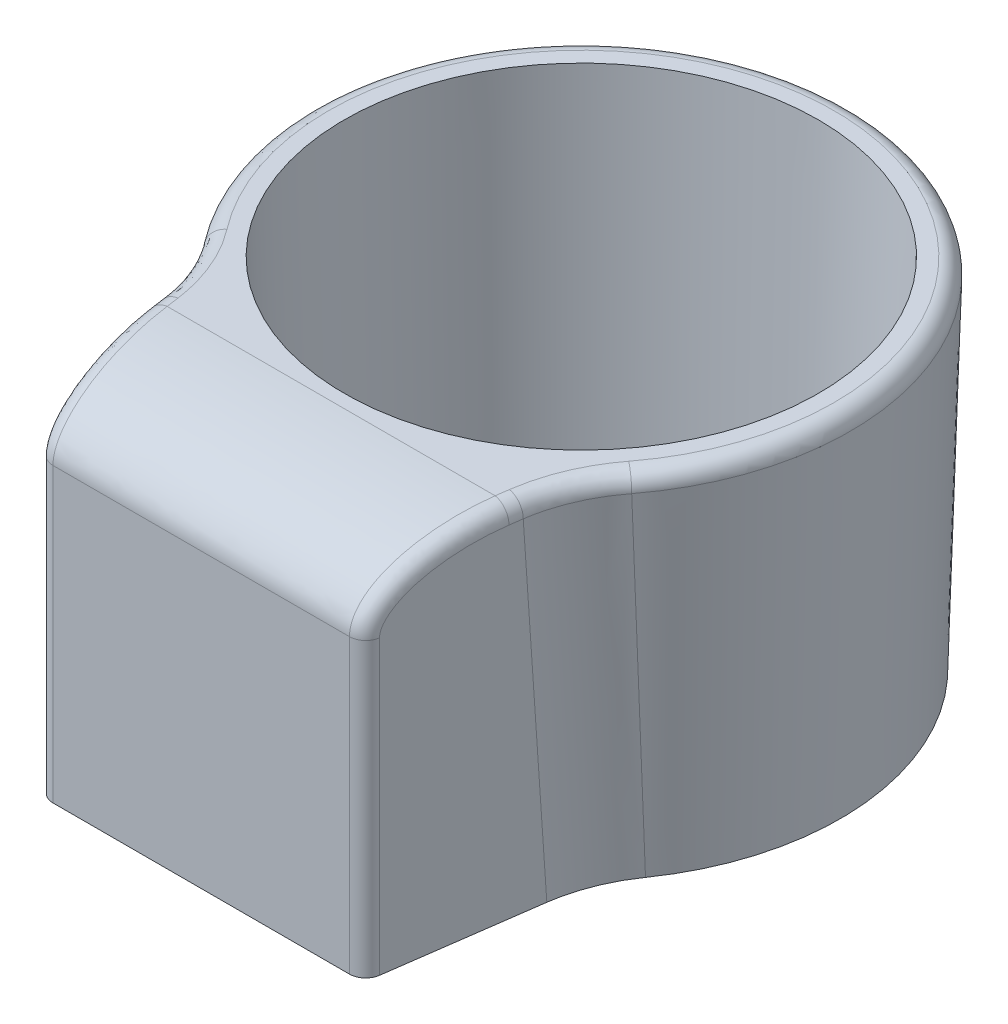
from build123d import *

# Parameters (mm, degrees)
BOSS_EXTRUDE1_DEPTH = 22
CUT_EXTRUDE1_DEPTH  = 20
BOSS_EXTRUDE2_DEPTH = 6.5
BOSS_EXTRUDE3_DEPTH = 10
FILLET1_R           = 10
FILLET3_SIZE        = 8
FILLET3_SIZE_2      = 4
FILLET5_R           = 1.5
FILLET6_R           = 1


with BuildPart() as part:
    # Sketch2 → Revolve1 (revolve)
    with BuildSketch(Plane.XY, mode=Mode.PRIVATE) as revolve1_sk:
        Polygon((-15.96, 0), (-16.6, 22), (-14.599153898, 22), (-13.959153898, 0), align=None)
    revolve(revolve1_sk.sketch.rotate(Axis((0, 0, 0), (0, 1, 0)), 270), axis=Axis((0, 0, 0), (0, 1, 0)))

    # Sketch4 → Boss-Extrude1 (add)
    with BuildSketch(Plane(origin=(0, 0, 0), x_dir=(1, 0, 0), z_dir=(0, 1, 0))):
        with BuildLine():
            Line((-11.75, -10.800884223), (-10, -23.41))
            Line((-10, -23.41), (10, -23.41))
            Line((10, -23.41), (11.75, -10.800884223))
            ThreePointArc((11.75, -10.800884223), (0, -15.96), (-11.75, -10.800884223))
        make_face()
    extrude(amount=BOSS_EXTRUDE1_DEPTH)

    # Sketch4<3> → Cut-Extrude1 (cut)
    with BuildSketch(Plane(origin=(0, 0, 0), x_dir=(1, 0, 0), z_dir=(0, 1, 0))):
        with BuildLine():
            Line((-10.009354966, -12.431187118), (-8.693804944, -21.91))
            Line((-8.693804944, -21.91), (8.693804944, -21.91))
            Line((8.693804944, -21.91), (10.009354966, -12.431187118))
            ThreePointArc((10.009354966, -12.431187118), (0, -15.96), (-10.009354966, -12.431187118))
        make_face()
    extrude(amount=CUT_EXTRUDE1_DEPTH, mode=Mode.SUBTRACT)

    # Sketch5 → Boss-Extrude2 (add)
    with BuildSketch(Plane.XZ.offset(-20)):
        Polygon((8.693804944, 21.91), (-8.693804944, 21.91), (-8.790956879, 21.21), (8.790956879, 21.21), align=None)
    extrude(amount=BOSS_EXTRUDE2_DEPTH)

    # Sketch6 → Boss-Extrude3 (add)
    with BuildSketch(Plane.XZ):
        Polygon((-9.080403606, 17.96), (-9.242019436, 17.96), (-9.519596394, 15.96), (-9.080403606, 15.96), align=None)
    extrude(amount=-BOSS_EXTRUDE3_DEPTH)

    # Fillet1
    fillet1_edges = [part.edges().sort_by_distance(p)[0] for p in [
        (-11.67423069, 10.999513918, 11.346817941),
        (11.67423069, 10.999513918, 11.346817941),
    ]]
    fillet(fillet1_edges, radius=FILLET1_R)

    # Fillet3
    # an asymmetric fillet: 8, 4 mm, written as the material it takes off along each edge
    with BuildSketch(Plane(origin=(-30, 22, 23.41), x_dir=(0, 0, -1), z_dir=(1, 0, 0))) as fillet3_piece_1:
        with BuildLine():
            Bezier((FILLET3_SIZE, 0), (0, 0), (0, -FILLET3_SIZE_2), weights=[1, 0.707106781, 1])
            Line((0, -FILLET3_SIZE_2), (0, 0))
            Line((0, 0), (FILLET3_SIZE, 0))
        make_face()
    extrude(amount=60, mode=Mode.SUBTRACT)

    # Fillet5
    fillet5_edges = [part.edges().sort_by_distance(p)[0] for p in [
        (8.693804944, 6.75, 21.91),
        (-8.693804944, 6.75, 21.91),
    ]]
    fillet(fillet5_edges, radius=FILLET5_R)

    # Fillet6
    fillet6_edges = [part.edges().sort_by_distance(p)[0] for p in [
        (-10, 9, 23.41),
        (-10.451604174, 21.220037197, 20.156097533),
        (-11.15016792, 22, 15.122799735),
        (-11.871933346, 22, 12.343102935),
        (-1e-09, 22, -16.6),
        (11.871933346, 22, 12.343102936),
        (11.15016792, 22, 15.122799736),
        (10.451604174, 21.220037197, 20.156097533),
        (10, 9, 23.41),
    ]]
    fillet(fillet6_edges, radius=FILLET6_R)


solid = part.part
